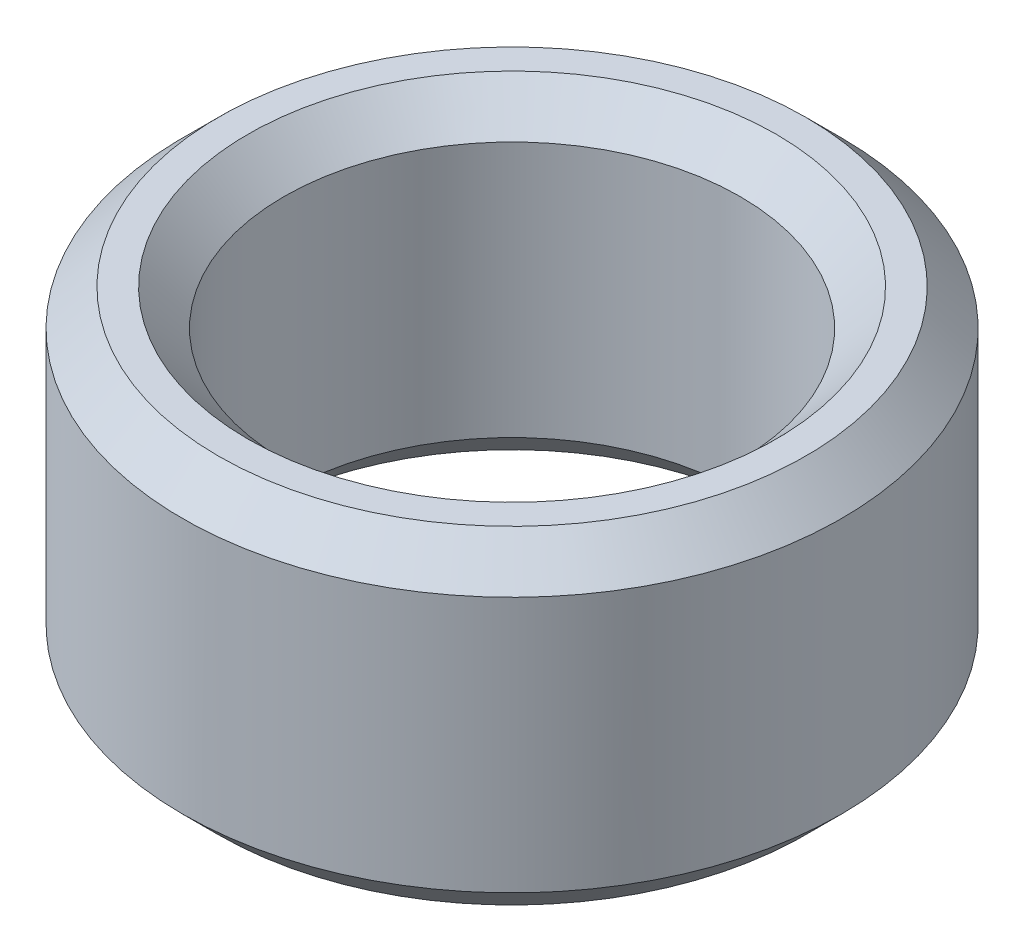
from build123d import *

# Parameters (mm, degrees)
SKETCH1_R           = 27.5
BOSS_EXTRUDE1_DEPTH = 27.364675875
SKETCH2_R           = 19.033814865
CUT_EXTRUDE1_DEPTH  = 48.553396154
CHAMFER1_SIZE       = 3.003375326


with BuildPart() as part:
    # Sketch1 → Boss-Extrude1 (new body)
    with BuildSketch(Plane(origin=(0, 0, 0), x_dir=(1, 0, 0), z_dir=(0, 1, 0))):
        Circle(SKETCH1_R)
    extrude(amount=BOSS_EXTRUDE1_DEPTH)

    # Sketch2 → Cut-Extrude1 (cut, through all)
    with BuildSketch(Plane(origin=(0, 0, 0), x_dir=(1, 0, 0), z_dir=(0, 1, 0))):
        Circle(SKETCH2_R)
    extrude(amount=CUT_EXTRUDE1_DEPTH, mode=Mode.SUBTRACT)

    # Chamfer1
    chamfer1_edges = [part.edges().sort_by_distance(p)[0] for p in [
        (-19.033814865, 27.364675875, 0),
        (-19.033814865, 0, 0),
        (-27.5, 0, 0),
        (-27.5, 27.364675875, 0),
    ]]
    chamfer(chamfer1_edges, length=CHAMFER1_SIZE)


solid = part.part
